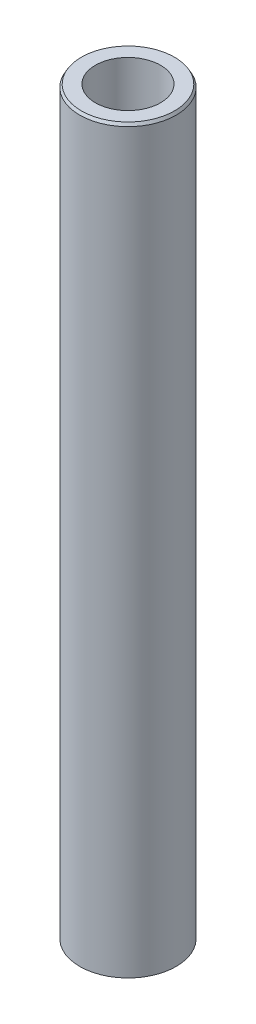
from build123d import *
from OCP.BRepFilletAPI import BRepFilletAPI_MakeChamfer

# Parameters (mm, degrees)
SKETCH1_R           = 32.5
BOSS_EXTRUDE1_DEPTH = 500.056925506
SKETCH2_R           = 21.965792677
CUT_EXTRUDE1_DEPTH  = 503.164742635
CHAMFER1_SIZE       = 1.925202619
CHAMFER1_SIZE2      = 1.11151625


with BuildPart() as part:
    # Sketch1 → Boss-Extrude1 (new body)
    with BuildSketch(Plane(origin=(0, 0, 0), x_dir=(1, 0, 0), z_dir=(0, 1, 0))):
        Circle(SKETCH1_R)
    extrude(amount=BOSS_EXTRUDE1_DEPTH)

    # Sketch2 → Cut-Extrude1 (cut, through all)
    with BuildSketch(Plane(origin=(0, 0, 0), x_dir=(1, 0, 0), z_dir=(0, 1, 0))):
        Circle(SKETCH2_R)
    extrude(amount=CUT_EXTRUDE1_DEPTH, mode=Mode.SUBTRACT)

    # Chamfer1: one chamfer whose edges measure the first distance from different faces: ONE call of the kernel's chamfer builder (chamfer() names one face for all edges)
    chamfer1_edges_1 = [part.edges().sort_by_distance(p)[0] for p in [
        (-32.5, 500.056925506, 0),
    ]]
    chamfer1_side_1 = [part.faces().sort_by_distance(p)[0] for p in [
        (-32.5, 250.028462753, 0),
    ]]
    chamfer1_edges_2 = [part.edges().sort_by_distance(p)[0] for p in [
        (-32.5, 0, 0),
    ]]
    chamfer1_side_2 = [part.faces().sort_by_distance(p)[0] for p in [
        (-31.580761184, 0, 0),
    ]]
    chamfer1 = BRepFilletAPI_MakeChamfer(part.part.solid().wrapped)
    for e in chamfer1_edges_1:
        chamfer1.Add(CHAMFER1_SIZE, CHAMFER1_SIZE2, e.wrapped, chamfer1_side_1[0].wrapped)  # the first distance lies on this face
    for e in chamfer1_edges_2:
        chamfer1.Add(CHAMFER1_SIZE, CHAMFER1_SIZE2, e.wrapped, chamfer1_side_2[0].wrapped)  # the first distance lies on this face
    add(Compound.cast(chamfer1.Shape()), mode=Mode.REPLACE)


solid = part.part
